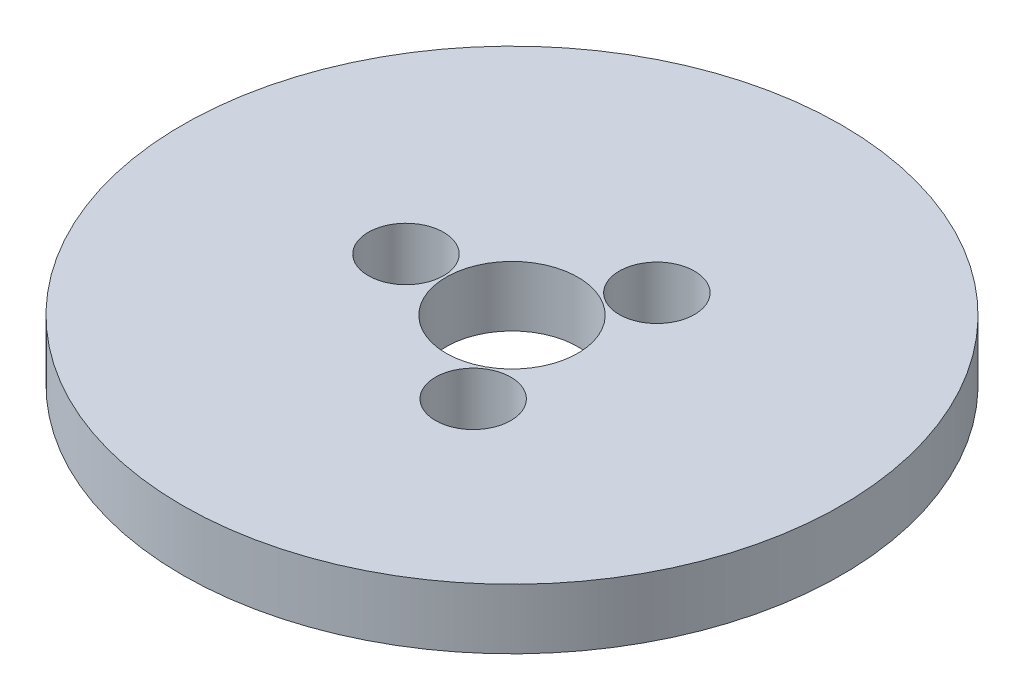
from build123d import *

# Parameters (mm, degrees)
SKETCH1_R           = 87.5
BOSS_EXTRUDE1_DEPTH = 16
SKETCH2_R           = 17.5
CUT_EXTRUDE1_DEPTH  = 125.773795326
SKETCH3_R           = 10
CUT_EXTRUDE2_DEPTH  = 14.654195864
CIRPATTERN1_COUNT   = 3


with BuildPart() as part:
    # Sketch1 → Boss-Extrude1 (new body)
    with BuildSketch(Plane(origin=(0, 0, 0), x_dir=(1, 0, 0), z_dir=(0, 1, 0))):
        Circle(SKETCH1_R)
    extrude(amount=BOSS_EXTRUDE1_DEPTH)

    # Sketch2 → Cut-Extrude1 (cut, through all)
    with BuildSketch(Plane(origin=(0, 0, 0), x_dir=(1, 0, 0), z_dir=(0, 1, 0))):
        Circle(SKETCH2_R)
    extrude(amount=CUT_EXTRUDE1_DEPTH, mode=Mode.SUBTRACT)

    # Sketch3 → Cut-Extrude2 (cut)
    with BuildSketch(Plane(origin=(0, 16, 0), x_dir=(1, 0, 0), z_dir=(0, 1, 0))):
        with Locations((-28.157545584, 0)):
            Circle(SKETCH3_R)
    cut_extrude2 = extrude(amount=-CUT_EXTRUDE2_DEPTH, mode=Mode.SUBTRACT)

    # CirPattern1: Cut-Extrude2 ×3 about axis
    cirpattern1_axis = Axis((0, 0, 0), (0, 1, 0))
    for i in range(1, CIRPATTERN1_COUNT):
        add(cut_extrude2.rotate(cirpattern1_axis, i * 360 / CIRPATTERN1_COUNT), mode=Mode.SUBTRACT)


solid = part.part
